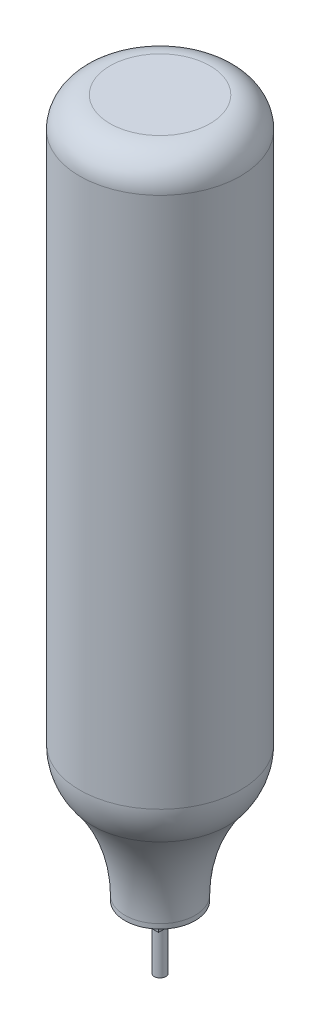
from build123d import *

# Parameters (mm, degrees)
SKETCH1_R           = 26.5
BOSS_EXTRUDE1_DEPTH = 230
SKETCH2_R           = 26.5
SKETCH2_R_2         = 11.564416293
CUT_EXTRUDE1_DEPTH  = 25.4
FILLET1_R           = 20
FILLET2_R           = 50
FILLET3_R           = 10
SKETCH3_W           = 6.947530086
SKETCH3_H           = 7.989839498
BOSS_EXTRUDE2_DEPTH = 5.4
SKETCH4_R           = 1.894960562
BOSS_EXTRUDE3_DEPTH = 15.4


with BuildPart() as part:
    # Sketch1 → Boss-Extrude1 (new body)
    with BuildSketch(Plane(origin=(0, 0, 0), x_dir=(1, 0, 0), z_dir=(0, 1, 0))):
        with Locations(Location((0, 0, 0), (0, 0, 270))):
            Circle(SKETCH1_R)
    extrude(amount=BOSS_EXTRUDE1_DEPTH)

    # Sketch2 → Cut-Extrude1 (cut)
    with BuildSketch(Plane.XZ):
        with Locations(Location((0, 0, 0), (0, 0, 270))):
            Circle(SKETCH2_R)
        with Locations(Location((0, 0, 0), (0, 0, 270))):
            Circle(SKETCH2_R_2, mode=Mode.SUBTRACT)
    extrude(amount=-CUT_EXTRUDE1_DEPTH, mode=Mode.SUBTRACT)

    # Fillet1
    # the kernel refuses this fillet: 20 mm, written as the material it takes off along each edge
    with BuildSketch(Plane(origin=(0, 25.4, 0), x_dir=(0, 0, 1), z_dir=(-1, 0, 0))) as fillet1_piece_1:
        with BuildLine():
            CenterArc((6.5, 19.348170136), FILLET1_R, 284.668185606, 75.331814394)
            Line((11.564416293, 0), (11.665704619, -0.386963403))
            ThreePointArc((11.665704619, -0.386963403), (19.032208147, -0.4), (26.5, -0.4))
            Line((26.5, -0.4), (26.9, 0))
            Line((26.9, 0), (26.9, 19.348170136))
            Line((26.9, 19.348170136), (26.5, 19.348170136))
        make_face()
    revolve(axis=Axis((0, 25.4, 0), (0, 1, 0)), mode=Mode.SUBTRACT)

    # Fillet2
    fillet2_edges = [part.edges().sort_by_distance(p)[0] for p in [
        (11.564416293, 25.4, 0),
    ]]
    fillet(fillet2_edges, radius=FILLET2_R)

    # Fillet3
    fillet3_edges = [part.edges().sort_by_distance(p)[0] for p in [
        (0, 230, -26.5),
    ]]
    fillet(fillet3_edges, radius=FILLET3_R)

    # Sketch3 → Boss-Extrude2 (add)
    with BuildSketch(Plane.XZ):
        Rectangle(SKETCH3_W, SKETCH3_H)
    extrude(amount=BOSS_EXTRUDE2_DEPTH)

    # Sketch4 → Boss-Extrude3 (add)
    with BuildSketch(Plane(origin=(0, -5.4, 0), x_dir=(-1, 0, 0), z_dir=(0, -1, 0))):
        with Locations(Location((0, 0, 0), (0, 0, 90))):
            Circle(SKETCH4_R)
    extrude(amount=BOSS_EXTRUDE3_DEPTH)


solid = part.part
